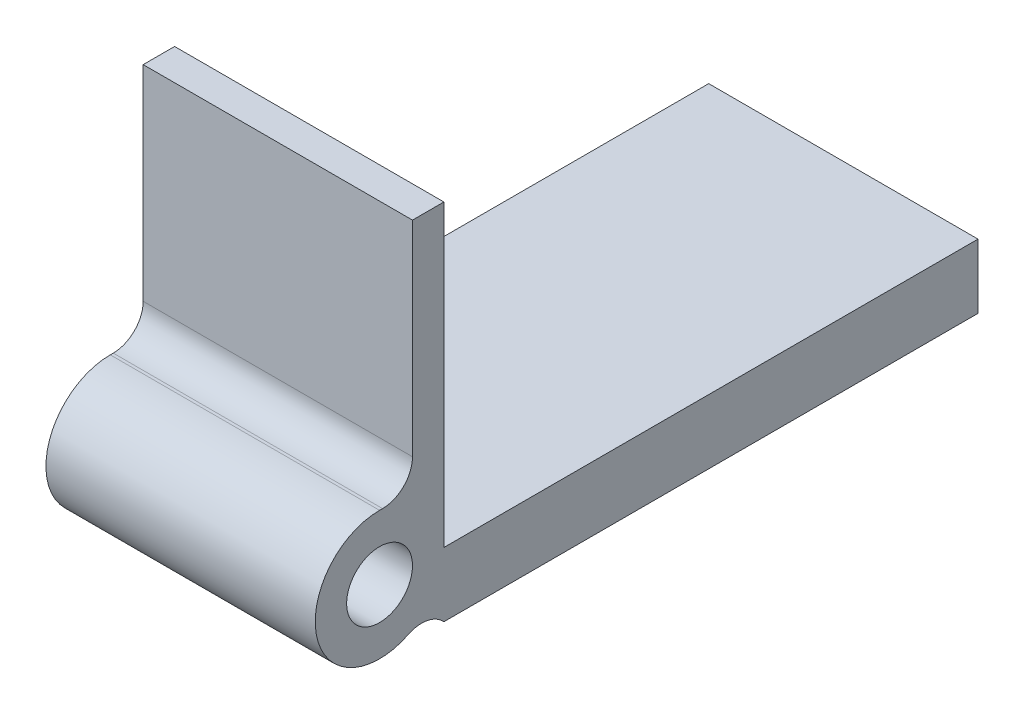
from build123d import *

# Parameters (mm, degrees)
SKETCH1_R           = 1.1
BOSS_EXTRUDE1_DEPTH = 4.5
FILLET1_R           = 1


with BuildPart() as part:
    # Sketch1 → Boss-Extrude1 (new, symmetric)
    with BuildSketch(Plane(origin=(0, 0, 0), x_dir=(0, 0, -1), z_dir=(1, 0, 0))):
        with BuildLine():
            Line((0, 2.15), (1.1, 2.15))
            Line((1.1, 2.15), (1.1, 10))
            Line((1.1, 10), (2.15, 10))
            Line((2.15, 10), (2.15, 0))
            Line((2.15, 0), (20, 0))
            Line((20, 0), (20, -2.15))
            Line((20, -2.15), (2.15, -2.15))
            Line((2.15, -2.15), (1.52027958, -1.52027958))
            ThreePointArc((1.52027958, -1.52027958), (-1.986340995, -0.82276938), (0, 2.15))
        make_face()
        Circle(SKETCH1_R, mode=Mode.SUBTRACT)
    extrude(amount=BOSS_EXTRUDE1_DEPTH, both=True)

    # Fillet1
    fillet1_edges = [part.edges().sort_by_distance(p)[0] for p in [
        (0, 2.15, -1.1),
        (0, -1.52027958, -1.52027958),
    ]]
    fillet(fillet1_edges, radius=FILLET1_R)


solid = part.part
